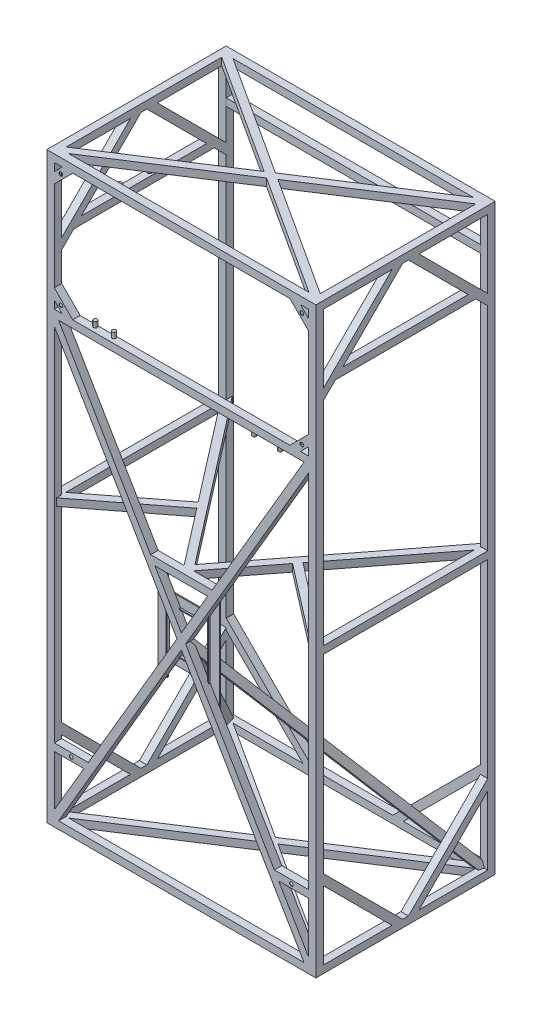
from build123d import *

# Parameters (mm, degrees)
SKETCH1_W                                      = 25.4
SKETCH1_H                                      = 25.4
SKETCH1_W_2                                    = 22.098
SKETCH1_H_2                                    = 22.098
SKETCH2_W                                      = 25.4
SKETCH2_H                                      = 25.4
SKETCH2_W_2                                    = 22.098
SKETCH2_H_2                                    = 22.098
SKETCH3_W                                      = 25.4
SKETCH3_H                                      = 25.4
SKETCH3_W_2                                    = 21.9456
SKETCH3_H_2                                    = 21.9456
CORNER_MAIN_BEAMS_REACH                        = 2033.524
SKETCH4_W                                      = 25.4
SKETCH4_H                                      = 25.4
SKETCH4_W_2                                    = 22.098
SKETCH4_H_2                                    = 22.098
SKETCH14_W                                     = 25.4
SKETCH14_H                                     = 25.4
BOSS_EXTRUDE2_DEPTH                            = 863.6
SKETCH7_W                                      = 25.4
SKETCH7_H                                      = 25.4
SKETCH7_W_2                                    = 22.098
SKETCH7_H_2                                    = 22.098
SKETCH6_W                                      = 25.4
SKETCH6_H                                      = 25.4
SKETCH6_W_2                                    = 22.098
SKETCH6_H_2                                    = 22.098
BOSS_EXTRUDE3_REACH                            = 1612.045
BOSS_EXTRUDE3_DIRECTION_2_REACH                = 1612.045
BOSS_EXTRUDE6_REACH                            = 1134.794
SKETCH30_W                                     = 25.4
SKETCH30_H                                     = 25.4
SKETCH30_W_2                                   = 22.098
SKETCH30_H_2                                   = 22.098
BOSS_EXTRUDE6_DIRECTION_2_REACH                = 1134.794
BOSS_EXTRUDE7_REACH                            = 2143.728
BOSS_EXTRUDE7_START                            = 127
SKETCH31_W                                     = 25.4
SKETCH31_H                                     = 25.4
SKETCH31_W_2                                   = 22.098
SKETCH31_H_2                                   = 22.098
BOSS_EXTRUDE7_DIRECTION_2_REACH                = 2143.728
MIRROR2_START                                  = 431.8
MIRROR2_DEPTH                                  = 25.4
MIRROR2_2_DEPTH                                = 1.651
MIRROR2_START_2                                = 455.549
MIRROR2_3_DEPTH                                = 1.651
MIRROR3_START                                  = -457.2
MIRROR3_DEPTH                                  = 25.4
MIRROR3_2_DEPTH                                = 1.651
MIRROR3_START_2                                = -433.451
MIRROR3_3_DEPTH                                = 1.651
BOSS_EXTRUDE8_REACH                            = 2092.803
BOSS_EXTRUDE8_START                            = -101.6
SKETCH32_W                                     = 25.4
SKETCH32_H                                     = 25.4
SKETCH32_W_2                                   = 22.098
SKETCH32_H_2                                   = 22.098
BOSS_EXTRUDE8_DIRECTION_2_REACH                = 2092.803
SKETCH33_W                                     = 107.95
SKETCH33_H                                     = 31.75
SKETCH33_W_2                                   = 31.75
SKETCH33_H_2                                   = 311.15
BOSS_EXTRUDE9_DEPTH                            = 3.4163
BOSS_EXTRUDE11_REACH                           = 1239.582
SKETCH37_W                                     = 25.4
SKETCH37_H                                     = 25.4
SKETCH37_W_2                                   = 22.098
SKETCH37_H_2                                   = 22.098
BOSS_EXTRUDE12_REACH                           = 1134.794
SKETCH38_W                                     = 25.4
SKETCH38_H                                     = 25.4
SKETCH38_W_2                                   = 22.098
SKETCH38_H_2                                   = 22.098
BOSS_EXTRUDE12_DIRECTION_2_REACH               = 1134.794
BOSS_EXTRUDE13_REACH                           = 1268.566
SKETCH39_W                                     = 25.4
SKETCH39_H                                     = 25.4
SKETCH39_W_2                                   = 22.098
SKETCH39_H_2                                   = 22.098
BOSS_EXTRUDE13_DIRECTION_2_REACH               = 1268.566
MIRROR6_START                                  = -50.8
MIRROR6_DEPTH                                  = 25.4
MIRROR6_2_DEPTH                                = 1.651
MIRROR6_START_2                                = -27.051
MIRROR6_3_DEPTH                                = 1.651
BOSS_EXTRUDE14_REACH                           = 1234.12
SKETCH40_W                                     = 25.4
SKETCH40_H                                     = 25.4
SKETCH40_W_2                                   = 22.225
SKETCH40_H_2                                   = 22.225
FUEL_SIDE_UPPER_TANK_GUIDE_REACH               = 1134.794
SKETCH42_W                                     = 25.4
SKETCH42_H                                     = 25.4
FUEL_SIDE_UPPER_TANK_GUIDE_DIRECTION_2_REACH   = 1134.794
LOWER_RIGHT_BLAST_SHIELD_MOUNT_REACH           = 1367.471
SKETCH41_W                                     = 25.4
SKETCH41_H                                     = 25.4
SKETCH41_W_2                                   = 22.225
SKETCH41_H_2                                   = 22.225
MIDDLE_RIGHT_BLAST_SHIELD_MOUNT_REACH          = 1961.027
MIDDLE_START                                   = 44.45
SKETCH43_W                                     = 25.4
SKETCH43_H                                     = 25.4
SKETCH43_W_2                                   = 22.225
SKETCH43_H_2                                   = 22.225
MIDDLE_RIGHT_BLAST_SHIELD_MOUNT_DIRECTIO_REACH = 1961.027
LEFT_START                                     = 279.4
LEFT_SIDE_BLAST_SHIELD_MOUNTS_DEPTH            = 25.4
LEFT_SIDE_BLAST_SHIELD_MOUNTS_2_DEPTH          = 1.5875
LEFT_START_2                                   = 303.2125
LEFT_SIDE_BLAST_SHIELD_MOUNTS_3_DEPTH          = 1.5875
BOSS_EXTRUDE20_DEPTH                           = 5.08
BOSS_EXTRUDE20_DEPTH_BACK                      = 3.4163
BOSS_EXTRUDE20_2_DEPTH                         = 5.08
BOSS_EXTRUDE20_2_DEPTH_BACK                    = 3.4163
BOSS_EXTRUDE20_3_DEPTH                         = 5.08
BOSS_EXTRUDE20_3_DEPTH_BACK                    = 3.4163
BOSS_EXTRUDE20_4_DEPTH                         = 5.08
BOSS_EXTRUDE20_4_DEPTH_BACK                    = 3.4163
SKETCH47_R                                     = 6.35
CUT_EXTRUDE3_DEPTH                             = 25.4
SKETCH46_R                                     = 6.35
CUT_EXTRUDE2_DEPTH                             = 1250.772923374
MIRROR15_COPY_1_SKETCH_R                       = 6.35
MIRROR15_COPY_1_DEPTH                          = 1250.772923374
SKETCH48_R                                     = 6.35
BOSS_EXTRUDE21_DEPTH                           = 19.05
SKETCH49_R                                     = 6.35
BOSS_EXTRUDE22_DEPTH                           = 19.05
SKETCH50_R                                     = 6.35
BOSS_EXTRUDE23_DEPTH                           = 19.05


with BuildPart() as part:
    # Top Box: sweep along a curve in space
    with BuildLine() as top_box_path:
        Line((0, 977.9, 292.1), (444.5, 977.9, 292.1))
        Line((444.5, 977.9, 292.1), (444.5, 977.9, -292.1))
        Line((444.5, 977.9, -292.1), (-444.5, 977.9, -292.1))
        Line((-444.5, 977.9, -292.1), (-444.5, 977.9, 292.1))
        Line((-444.5, 977.9, 292.1), (0, 977.9, 292.1))
    # Sketch1 → Top Box (sweep)
    with BuildSketch(Plane(origin=(0, 0, 0), x_dir=(0, 0, -1), z_dir=(1, 0, 0))):
        with Locations((-292.1, 977.9)):
            Rectangle(SKETCH1_W, SKETCH1_H)
        with Locations((-292.1, 977.9)):
            Rectangle(SKETCH1_W_2, SKETCH1_H_2, mode=Mode.SUBTRACT)
    sweep(path=top_box_path.line, transition=Transition.RIGHT)

    # Top X1: sweep along a curve in space
    with BuildLine() as top_x1_path:
        Line((-431.8, 977.9, -279.4), (431.8, 977.9, 279.4))
    # Sketch2 → Top X1 (sweep)
    with BuildSketch(Plane(origin=(-431.8, 0, -279.4), x_dir=(0.5432512781572741, 0, -0.8395701571521512), z_dir=(0.8395701571521512, 0, 0.5432512781572741))):
        with Locations((0, 977.9)):
            Rectangle(SKETCH2_W, SKETCH2_H)
        with Locations((0, 977.9)):
            Rectangle(SKETCH2_W_2, SKETCH2_H_2, mode=Mode.SUBTRACT)
    sweep(path=top_x1_path.line)

    # Top X2: sweep along a curve in space
    with BuildLine() as top_x2_path:
        Line((-431.8, 977.9, 279.4), (431.8, 977.9, -279.4))
    # Sketch3 → Top X2 (sweep)
    with BuildSketch(Plane(origin=(431.8, 0, -279.4), x_dir=(-0.5432512781572741, 0, -0.8395701571521513), z_dir=(0.8395701571521513, 0, -0.5432512781572741))):
        with Locations((0, 977.9)):
            Rectangle(SKETCH3_W, SKETCH3_H)
        with Locations((0, 977.9)):
            Rectangle(SKETCH3_W_2, SKETCH3_H_2, mode=Mode.SUBTRACT)
    sweep(path=top_x2_path.line)


with BuildPart() as body_2:
    # 2X3 bottom and X: mirrored copy
    add(part.part.mirror(Plane.ZX))


with BuildPart() as part_1:
    add(part.part)

    # Sketch4 → Corner Main Beams (add, up to next)
    with BuildSketch(Plane(origin=(0, -965.2, 0), x_dir=(1, 0, 0), z_dir=(0, 1, 0)), mode=Mode.PRIVATE) as corner_main_beams_sk1:
        with Locations((-444.5, -292.1)):
            Rectangle(SKETCH4_W, SKETCH4_H)
        with Locations((-444.5, -292.1)):
            Rectangle(SKETCH4_W_2, SKETCH4_H_2, mode=Mode.SUBTRACT)
    corner_main_beams_tool1 = extrude(corner_main_beams_sk1.sketch, amount=CORNER_MAIN_BEAMS_REACH, mode=Mode.PRIVATE) - part_1.part
    # Sketch4 → Corner Main Beams (add, up to next)
    with BuildSketch(Plane(origin=(0, -965.2, 0), x_dir=(1, 0, 0), z_dir=(0, 1, 0)), mode=Mode.PRIVATE) as corner_main_beams_sk2:
        with Locations((444.5, -292.1)):
            Rectangle(SKETCH4_W, SKETCH4_H)
        with Locations((444.5, -292.1)):
            Rectangle(SKETCH4_W_2, SKETCH4_H_2, mode=Mode.SUBTRACT)
    corner_main_beams_tool2 = extrude(corner_main_beams_sk2.sketch, amount=CORNER_MAIN_BEAMS_REACH, mode=Mode.PRIVATE) - part_1.part
    # Sketch4 → Corner Main Beams (add, up to next)
    with BuildSketch(Plane(origin=(0, -965.2, 0), x_dir=(1, 0, 0), z_dir=(0, 1, 0)), mode=Mode.PRIVATE) as corner_main_beams_sk3:
        with Locations((444.5, 292.1)):
            Rectangle(SKETCH4_W, SKETCH4_H)
        with Locations((444.5, 292.1)):
            Rectangle(SKETCH4_W_2, SKETCH4_H_2, mode=Mode.SUBTRACT)
    corner_main_beams_tool3 = extrude(corner_main_beams_sk3.sketch, amount=CORNER_MAIN_BEAMS_REACH, mode=Mode.PRIVATE) - part_1.part
    # Sketch4 → Corner Main Beams (add, up to next)
    with BuildSketch(Plane(origin=(0, -965.2, 0), x_dir=(1, 0, 0), z_dir=(0, 1, 0)), mode=Mode.PRIVATE) as corner_main_beams_sk4:
        with Locations((-444.5, 292.1)):
            Rectangle(SKETCH4_W, SKETCH4_H)
        with Locations((-444.5, 292.1)):
            Rectangle(SKETCH4_W_2, SKETCH4_H_2, mode=Mode.SUBTRACT)
    corner_main_beams_tool4 = extrude(corner_main_beams_sk4.sketch, amount=CORNER_MAIN_BEAMS_REACH, mode=Mode.PRIVATE) - part_1.part

    add(body_2.part)  # Corner Main Beams merges body 2
    add(corner_main_beams_tool1.solids().sort_by_distance((-444.5, -965.2, 304.44079))[0])
    add(corner_main_beams_tool2.solids().sort_by_distance((432.15921, -965.2, 292.1))[0])
    add(corner_main_beams_tool3.solids().sort_by_distance((444.5, -965.2, -304.44079))[0])
    add(corner_main_beams_tool4.solids().sort_by_distance((-432.15921, -965.2, -292.1))[0])

    # Sketch14 → Boss-Extrude2 (add)
    with BuildSketch(Plane(origin=(-431.8, 0, 0), x_dir=(0, 0, -1), z_dir=(1, 0, 0))):
        with Locations((-292.1, 520.7)):
            Rectangle(SKETCH14_W, SKETCH14_H)
    extrude(amount=BOSS_EXTRUDE2_DEPTH)

    # Front X1: sweep along a curve in space
    with BuildLine() as front_x1_path:
        Line((431.8, -965.2, 292.1), (-431.8, 508, 292.1))
    # Sketch7 → Front X1 (sweep)
    with BuildSketch(Plane(origin=(531.534336283, -906.735044248, 0), x_dir=(0.8626979700976566, 0.5057194997124227, 0), z_dir=(-0.5057194997124227, 0.8626979700976566, 0))):
        with Locations((-115.607477634, -292.1)):
            Rectangle(SKETCH7_W, SKETCH7_H)
        with Locations((-115.607477634, -292.1)):
            Rectangle(SKETCH7_W_2, SKETCH7_H_2, mode=Mode.SUBTRACT)
    sweep(path=front_x1_path.line)

    # Front X 2: sweep along a curve in space
    with BuildLine() as front_x_2_path:
        Line((-431.8, -965.2, 292.1), (431.8, 508, 292.1))
    # Sketch6 → Front X 2 (sweep)
    with BuildSketch(Plane(origin=(-531.534336283, -906.735044248, 0), x_dir=(0.8626979700976565, -0.5057194997124226, 0), z_dir=(0.5057194997124226, 0.8626979700976565, 0))):
        with Locations((115.607477634, -292.1)):
            Rectangle(SKETCH6_W, SKETCH6_H)
        with Locations((115.607477634, -292.1)):
            Rectangle(SKETCH6_W_2, SKETCH6_H_2, mode=Mode.SUBTRACT)
    sweep(path=front_x_2_path.line)

    # Sketch17 → Boss-Extrude3 (add, up to next)
    with BuildSketch(Plane(origin=(128.09702816, -447.118459802, 122.559815671), x_dir=(0.9073458854113775, 0.32526781479837374, 0.26631615212625476), z_dir=(-0.42026584041934634, 0.7169240807153511, 0.5562342005550085)), mode=Mode.PRIVATE) as boss_extrude3_sk1:
        Polygon((12.83923571, -12.559220772), (-12.559220772, -12.83923571), (-12.83923571, 12.559220772), (12.559220772, 12.83923571), align=None)
        Polygon((-11.170135067, 10.926522071), (-10.926522071, -11.170135067), (11.170135067, -10.926522071), (10.926522071, 11.170135067), align=None, mode=Mode.SUBTRACT)
    boss_extrude3_tool1 = extrude(boss_extrude3_sk1.sketch, amount=BOSS_EXTRUDE3_REACH, mode=Mode.PRIVATE) - part_1.part
    boss_extrude3 = boss_extrude3_tool1.solids().sort_by_distance((128.097028, -454.680914, 132.306979))[0]
    add(boss_extrude3)

    # Sketch17 → Boss-Extrude3 direction 2 (add, up to next)
    with BuildSketch(Plane(origin=(128.09702816, -447.118459802, 122.559815671), x_dir=(0.9073458854113775, 0.32526781479837374, 0.26631615212625476), z_dir=(-0.42026584041934634, 0.7169240807153511, 0.5562342005550085)), mode=Mode.PRIVATE) as boss_extrude3_direction_2_sk1:
        Polygon((12.83923571, -12.559220772), (-12.559220772, -12.83923571), (-12.83923571, 12.559220772), (12.559220772, 12.83923571), align=None)
        Polygon((-11.170135067, 10.926522071), (-10.926522071, -11.170135067), (11.170135067, -10.926522071), (10.926522071, 11.170135067), align=None, mode=Mode.SUBTRACT)
    boss_extrude3_direction_2_tool1 = extrude(boss_extrude3_direction_2_sk1.sketch, amount=-BOSS_EXTRUDE3_DIRECTION_2_REACH, mode=Mode.PRIVATE) - part_1.part
    boss_extrude3_direction_2 = boss_extrude3_direction_2_tool1.solids().sort_by_distance((128.097028, -454.680914, 132.306979))[0]
    add(boss_extrude3_direction_2)

    # Mirror9: Boss-Extrude3, Boss-Extrude3 direction 2 mirrored; each copy of Boss-Extrude3, Boss-Extrude3 direction 2 runs up to whatever stops it at its own place
    mirror9_before = part_1.part  # the part as the pattern finds it: every copy runs up to it
    mirror9_boss_extrude3_long = extrude(boss_extrude3_sk1.sketch, amount=BOSS_EXTRUDE3_REACH, mode=Mode.PRIVATE)
    mirror9_boss_extrude3_tool1 = mirror9_boss_extrude3_long.mirror(Plane(origin=(0, 0, 0), x_dir=(0, 0, 1), z_dir=(1, 0, 0))) - mirror9_before
    add(mirror9_boss_extrude3_tool1.solids().sort_by_distance((-128.097028, -454.680914, 132.306979))[0])
    mirror9_boss_extrude3_direction_2_long = extrude(boss_extrude3_direction_2_sk1.sketch, amount=-BOSS_EXTRUDE3_DIRECTION_2_REACH, mode=Mode.PRIVATE)
    mirror9_boss_extrude3_direction_2_tool1 = mirror9_boss_extrude3_direction_2_long.mirror(Plane(origin=(0, 0, 0), x_dir=(0, 0, 1), z_dir=(1, 0, 0))) - mirror9_before
    add(mirror9_boss_extrude3_direction_2_tool1.solids().sort_by_distance((-128.097028, -454.680914, 132.306979))[0])


with BuildPart() as body_2_2:

    # Sketch30 → Boss-Extrude6 (new, up to next)
    with BuildSketch(Plane.ZY, mode=Mode.PRIVATE) as boss_extrude6_sk1:
        with Locations((-292.1, 850.9)):
            Rectangle(SKETCH30_W, SKETCH30_H)
        with Locations((-292.1, 850.9)):
            Rectangle(SKETCH30_W_2, SKETCH30_H_2, mode=Mode.SUBTRACT)
    boss_extrude6_tool1 = extrude(boss_extrude6_sk1.sketch, amount=BOSS_EXTRUDE6_REACH, mode=Mode.PRIVATE) - part_1.part
    add(boss_extrude6_tool1.solids().sort_by_distance((0, 863.24079, -292.1))[0])


    # Sketch30 → Boss-Extrude6 direction 2 (add, up to next)
    with BuildSketch(Plane.ZY, mode=Mode.PRIVATE) as boss_extrude6_direction_2_sk1:
        with Locations((-292.1, 850.9)):
            Rectangle(SKETCH30_W, SKETCH30_H)
        with Locations((-292.1, 850.9)):
            Rectangle(SKETCH30_W_2, SKETCH30_H_2, mode=Mode.SUBTRACT)
    boss_extrude6_direction_2_tool1 = extrude(boss_extrude6_direction_2_sk1.sketch, amount=-BOSS_EXTRUDE6_DIRECTION_2_REACH, mode=Mode.PRIVATE) - part_1.part
    add(boss_extrude6_direction_2_tool1.solids().sort_by_distance((0, 863.24079, -292.1))[0])


with BuildPart() as part_2:
    add(part_1.part)

    # Boss-Extrude7: up to this plane
    boss_extrude7_end = Plane(origin=(-516.342048969, 965.2, 304.8), z_dir=(0, -1, 0))
    # Sketch31 → Boss-Extrude7 (add, up to the surface)
    with BuildSketch(Plane(origin=(444.5, 713.74, 279.4), x_dir=(1, 0, 0), z_dir=(0, 0.7071067811865718, -0.7071067811865234)).offset(BOSS_EXTRUDE7_START), mode=Mode.PRIVATE) as boss_extrude7_sk1:
        Rectangle(SKETCH31_W, SKETCH31_H)
        Rectangle(SKETCH31_W_2, SKETCH31_H_2, mode=Mode.SUBTRACT)
    boss_extrude7_tool1 = split(extrude(boss_extrude7_sk1.sketch, amount=BOSS_EXTRUDE7_REACH, mode=Mode.PRIVATE), bisect_by=boss_extrude7_end, keep=Keep.BOTH, mode=Mode.PRIVATE)
    boss_extrude7 = boss_extrude7_tool1.solids().sort_by_distance((444.5, 794.816305, 180.871183))[0]
    add(boss_extrude7)

    # Boss-Extrude7 direction 2: up to this plane
    boss_extrude7_direction_2_end = Plane(origin=(-457.2, 500000, 279.4), z_dir=(0, 0, 1))
    # Sketch31 → Boss-Extrude7 direction 2 (add, up to the surface)
    with BuildSketch(Plane(origin=(444.5, 713.74, 279.4), x_dir=(1, 0, 0), z_dir=(0, 0.7071067811865718, -0.7071067811865234)).offset(BOSS_EXTRUDE7_START), mode=Mode.PRIVATE) as boss_extrude7_direction_2_sk1:
        Rectangle(SKETCH31_W, SKETCH31_H)
        Rectangle(SKETCH31_W_2, SKETCH31_H_2, mode=Mode.SUBTRACT)
    boss_extrude7_direction_2_tool1 = split(extrude(boss_extrude7_direction_2_sk1.sketch, amount=-BOSS_EXTRUDE7_DIRECTION_2_REACH, mode=Mode.PRIVATE), bisect_by=boss_extrude7_direction_2_end, keep=Keep.BOTH, mode=Mode.PRIVATE)
    boss_extrude7_direction_2 = boss_extrude7_direction_2_tool1.solids().sort_by_distance((444.5, 794.816305, 180.871183))[0]
    add(boss_extrude7_direction_2)
    boss_extrude7 = boss_extrude7 + boss_extrude7_direction_2  # both directions under the feature's name, for the pattern or mirror that repeats it

    # Mirror1: Boss-Extrude7 across plane
    add(boss_extrude7.mirror(Plane.XY))

    # Mirror2: read off the stored shape, not the designer's step
    # Mirror2 outline → Mirror2 (add)
    with BuildSketch(Plane.YZ.offset(MIRROR2_START)):
        Polygon((-965.2, -43.565645651), (-965.2, -45.900512242), (-731.700512242, -279.4), (-729.365645651, -279.4), align=None)
        Polygon((-965.2, 12.314354349), (-965.2, 9.979487758), (-695.779487758, 279.4), (-698.114354349, 279.4), align=None)
        Polygon((-965.2, -9.979487758), (-965.2, -12.314354349), (-698.114354349, -279.4), (-695.779487758, -279.4), align=None)
        Polygon((-965.2, 45.900512242), (-965.2, 43.565645651), (-729.365645651, 279.4), (-731.700512242, 279.4), align=None)
    extrude(amount=MIRROR2_DEPTH)

    # Mirror2 2 outline → Mirror2 2 (add)
    with BuildSketch(Plane.YZ.offset(MIRROR2_START)):
        Polygon((-965.2, -12.314354349), (-965.2, -43.565645651), (-729.365645651, -279.4), (-698.114354349, -279.4), align=None)
        Polygon((-965.2, 43.565645651), (-965.2, 12.314354349), (-698.114354349, 279.4), (-729.365645651, 279.4), align=None)
    extrude(amount=MIRROR2_2_DEPTH)

    # Mirror2 3 outline → Mirror2 3 (add)
    with BuildSketch(Plane.YZ.offset(MIRROR2_START_2)):
        Polygon((-965.2, -12.314354349), (-965.2, -43.565645651), (-729.365645651, -279.4), (-698.114354349, -279.4), align=None)
        Polygon((-965.2, 43.565645651), (-965.2, 12.314354349), (-698.114354349, 279.4), (-729.365645651, 279.4), align=None)
    extrude(amount=MIRROR2_3_DEPTH)

    # Mirror3: read off the stored shape, not the designer's step
    # Mirror3 outline → Mirror3 (add)
    with BuildSketch(Plane.YZ.offset(MIRROR3_START)):
        Polygon((965.2, 45.900512242), (731.700512242, 279.4), (729.365645651, 279.4), (965.2, 43.565645651), align=None)
        Polygon((965.2, 12.314354349), (698.114354349, 279.4), (695.779487758, 279.4), (965.2, 9.979487758), align=None)
        Polygon((965.2, -12.314354349), (965.2, -9.979487758), (695.779487758, -279.4), (698.114354349, -279.4), align=None)
        Polygon((-965.2, 9.979487758), (-695.779487758, 279.4), (-698.114354349, 279.4), (-965.2, 12.314354349), align=None)
        Polygon((-698.114354349, -279.4), (-695.779487758, -279.4), (-965.2, -9.979487758), (-965.2, -12.314354349), align=None)
        Polygon((965.2, -45.900512242), (965.2, -43.565645651), (729.365645651, -279.400000001), (731.700512242, -279.4), align=None)
        Polygon((-965.2, 43.565645651), (-729.365645651, 279.400000001), (-731.700512242, 279.4), (-965.2, 45.900512242), align=None)
        Polygon((-731.700512242, -279.4), (-729.365645651, -279.4), (-965.2, -43.565645651), (-965.2, -45.900512242), align=None)
    extrude(amount=MIRROR3_DEPTH)

    # Mirror3 2 outline → Mirror3 2 (add)
    with BuildSketch(Plane.YZ.offset(MIRROR3_START)):
        Polygon((965.2, 43.565645651), (729.365645651, 279.4), (698.114354349, 279.4), (965.2, 12.314354349), align=None)
        Polygon((965.2, -43.565645651), (965.2, -12.314354349), (698.114354349, -279.4), (729.365645651, -279.4), align=None)
        Polygon((-965.2, 12.314354349), (-698.114354349, 279.4), (-729.365645651, 279.4), (-965.2, 43.565645651), align=None)
        Polygon((-729.365645651, -279.4), (-698.114354349, -279.4), (-965.2, -12.314354349), (-965.2, -43.565645651), align=None)
    extrude(amount=MIRROR3_2_DEPTH)

    # Mirror3 3 outline → Mirror3 3 (add)
    with BuildSketch(Plane.YZ.offset(MIRROR3_START_2)):
        Polygon((965.2, 43.565645651), (729.365645651, 279.4), (698.114354349, 279.4), (965.2, 12.314354349), align=None)
        Polygon((965.2, -43.565645651), (965.2, -12.314354349), (698.114354349, -279.4), (729.365645651, -279.4), align=None)
        Polygon((-965.2, 12.314354349), (-698.114354349, 279.4), (-729.365645651, 279.4), (-965.2, 43.565645651), align=None)
        Polygon((-729.365645651, -279.4), (-698.114354349, -279.4), (-965.2, -12.314354349), (-965.2, -43.565645651), align=None)
    extrude(amount=MIRROR3_3_DEPTH)

    # Boss-Extrude8: up to this plane
    boss_extrude8_end = Plane(origin=(431.8, 990.6, -279.4), z_dir=(1, 0, 0))
    # Sketch32 → Boss-Extrude8 (add, up to the surface)
    with BuildSketch(Plane(origin=(431.8, -685.8, -292.1), x_dir=(0.7071067811865479, -0.7071067811865472, 0), z_dir=(0.7071067811865472, 0.7071067811865479, 0)).offset(BOSS_EXTRUDE8_START), mode=Mode.PRIVATE) as boss_extrude8_sk1:
        Rectangle(SKETCH32_W, SKETCH32_H)
        Rectangle(SKETCH32_W_2, SKETCH32_H_2, mode=Mode.SUBTRACT)
    boss_extrude8_tool1 = split(extrude(boss_extrude8_sk1.sketch, amount=BOSS_EXTRUDE8_REACH, mode=Mode.PRIVATE), bisect_by=boss_extrude8_end, keep=Keep.BOTH, mode=Mode.PRIVATE)
    boss_extrude8 = boss_extrude8_tool1.solids().sort_by_distance((359.957951, -757.642049, -304.44079))[0]
    add(boss_extrude8)

    # Boss-Extrude8 direction 2: up to this plane
    boss_extrude8_direction_2_end = Plane(origin=(-516.342048969, -965.2, 304.8), z_dir=(0, 1, 0))
    # Sketch32 → Boss-Extrude8 direction 2 (add, up to the surface)
    with BuildSketch(Plane(origin=(431.8, -685.8, -292.1), x_dir=(0.7071067811865479, -0.7071067811865472, 0), z_dir=(0.7071067811865472, 0.7071067811865479, 0)).offset(BOSS_EXTRUDE8_START), mode=Mode.PRIVATE) as boss_extrude8_direction_2_sk1:
        Rectangle(SKETCH32_W, SKETCH32_H)
        Rectangle(SKETCH32_W_2, SKETCH32_H_2, mode=Mode.SUBTRACT)
    boss_extrude8_direction_2_tool1 = split(extrude(boss_extrude8_direction_2_sk1.sketch, amount=-BOSS_EXTRUDE8_DIRECTION_2_REACH, mode=Mode.PRIVATE), bisect_by=boss_extrude8_direction_2_end, keep=Keep.BOTH, mode=Mode.PRIVATE)
    boss_extrude8_direction_2 = boss_extrude8_direction_2_tool1.solids().sort_by_distance((359.957951, -757.642049, -304.44079))[0]
    add(boss_extrude8_direction_2)
    boss_extrude8 = boss_extrude8 + boss_extrude8_direction_2  # both directions under the feature's name, for the pattern or mirror that repeats it

    # Mirror4: Boss-Extrude8 across plane
    add(boss_extrude8.mirror(Plane(origin=(0, 0, 0), x_dir=(0, 0, 1), z_dir=(1, 0, 0))))

    # Sketch33 → Boss-Extrude9 (add)
    with BuildSketch(Plane(origin=(0, 0, 279.4), x_dir=(-1, 0, 0), z_dir=(0, 0, -1))):
        with Locations((0, -140.0175)):
            Rectangle(SKETCH33_W, SKETCH33_H)
        with Locations((0, -317.1825)):
            Rectangle(SKETCH33_W, SKETCH33_H)
        with Locations((-88.5825, -228.6)):
            Rectangle(SKETCH33_W_2, SKETCH33_H_2)
        with Locations((88.5825, -228.6)):
            Rectangle(SKETCH33_W_2, SKETCH33_H_2)
    extrude(amount=BOSS_EXTRUDE9_DEPTH)

    # Sketch37 → Boss-Extrude11 (add, up to next)
    with BuildSketch(Plane(origin=(0, 0, 279.4), x_dir=(-1, 0, 0), z_dir=(0, 0, -1)), mode=Mode.PRIVATE) as boss_extrude11_sk1:
        with Locations((444.5, -38.1)):
            Rectangle(SKETCH37_W, SKETCH37_H)
        with Locations((444.5, -38.1)):
            Rectangle(SKETCH37_W_2, SKETCH37_H_2, mode=Mode.SUBTRACT)
    boss_extrude11_tool1 = extrude(boss_extrude11_sk1.sketch, amount=BOSS_EXTRUDE11_REACH, mode=Mode.PRIVATE) - part_2.part
    boss_extrude11 = boss_extrude11_tool1.solids().sort_by_distance((-444.5, -25.75921, 279.4))[0]
    add(boss_extrude11)

    # Mirror5: Boss-Extrude11 across plane
    add(boss_extrude11.mirror(Plane(origin=(0, 0, 0), x_dir=(0, 0, 1), z_dir=(1, 0, 0))))



with BuildPart() as body_3:
    # Boss-Extrude12: up to this plane
    boss_extrude12_end = Plane(origin=(-420.84373578, 514.422637646, 279.4), z_dir=(-0.8626979700976565, -0.5057194997124227, 0))
    # Sketch38 → Boss-Extrude12 (new, up to the surface)
    with BuildSketch(Plane.ZY, mode=Mode.PRIVATE) as boss_extrude12_sk1:
        with Locations((292.1, -38.1)):
            Rectangle(SKETCH38_W, SKETCH38_H)
        with Locations((292.1, -38.1)):
            Rectangle(SKETCH38_W_2, SKETCH38_H_2, mode=Mode.SUBTRACT)
    boss_extrude12_tool1 = split(extrude(boss_extrude12_sk1.sketch, amount=BOSS_EXTRUDE12_REACH, mode=Mode.PRIVATE), bisect_by=boss_extrude12_end, keep=Keep.BOTH, mode=Mode.PRIVATE)
    add(boss_extrude12_tool1.solids().sort_by_distance((0, -25.75921, 292.1))[0])

    # Boss-Extrude12 direction 2: up to this plane
    boss_extrude12_direction_2_end = Plane(origin=(420.84373578, 514.422637646, 279.4), z_dir=(0.8626979700976565, -0.5057194997124227, 0))
    # Sketch38 → Boss-Extrude12 direction 2 (add, up to the surface)
    with BuildSketch(Plane.ZY, mode=Mode.PRIVATE) as boss_extrude12_direction_2_sk1:
        with Locations((292.1, -38.1)):
            Rectangle(SKETCH38_W, SKETCH38_H)
        with Locations((292.1, -38.1)):
            Rectangle(SKETCH38_W_2, SKETCH38_H_2, mode=Mode.SUBTRACT)
    boss_extrude12_direction_2_tool1 = split(extrude(boss_extrude12_direction_2_sk1.sketch, amount=-BOSS_EXTRUDE12_DIRECTION_2_REACH, mode=Mode.PRIVATE), bisect_by=boss_extrude12_direction_2_end, keep=Keep.BOTH, mode=Mode.PRIVATE)
    add(boss_extrude12_direction_2_tool1.solids().sort_by_distance((0, -25.75921, 292.1))[0])


with BuildPart() as part_3:
    add(part_2.part)

    add(body_3.part)  # Boss-Extrude13 merges body 3
    # Boss-Extrude13: up to this plane
    boss_extrude13_end = Plane(origin=(500000, -25.4, 279.4), z_dir=(0, 0, -1))
    # Sketch39 → Boss-Extrude13 (add, up to the surface)
    with BuildSketch(Plane(origin=(215.9, -38.1, 0), x_dir=(0.7912850013921422, 0, 0.6114475010757978), z_dir=(-0.6114475010757978, 0, 0.7912850013921422)), mode=Mode.PRIVATE) as boss_extrude13_sk1:
        Rectangle(SKETCH39_W, SKETCH39_H)
        Rectangle(SKETCH39_W_2, SKETCH39_H_2, mode=Mode.SUBTRACT)
    boss_extrude13_tool1 = split(extrude(boss_extrude13_sk1.sketch, amount=BOSS_EXTRUDE13_REACH, mode=Mode.PRIVATE), bisect_by=boss_extrude13_end, keep=Keep.BOTH, mode=Mode.PRIVATE)
    add(boss_extrude13_tool1.solids().sort_by_distance((215.9, -25.75921, 0))[0])

    # Boss-Extrude13 direction 2: up to this plane
    boss_extrude13_direction_2_end = Plane(origin=(431.8, 990.6, -279.4), z_dir=(1, 0, 0))
    # Sketch39 → Boss-Extrude13 direction 2 (add, up to the surface)
    with BuildSketch(Plane(origin=(215.9, -38.1, 0), x_dir=(0.7912850013921422, 0, 0.6114475010757978), z_dir=(-0.6114475010757978, 0, 0.7912850013921422)), mode=Mode.PRIVATE) as boss_extrude13_direction_2_sk1:
        Rectangle(SKETCH39_W, SKETCH39_H)
        Rectangle(SKETCH39_W_2, SKETCH39_H_2, mode=Mode.SUBTRACT)
    boss_extrude13_direction_2_tool1 = split(extrude(boss_extrude13_direction_2_sk1.sketch, amount=-BOSS_EXTRUDE13_DIRECTION_2_REACH, mode=Mode.PRIVATE), bisect_by=boss_extrude13_direction_2_end, keep=Keep.BOTH, mode=Mode.PRIVATE)
    add(boss_extrude13_direction_2_tool1.solids().sort_by_distance((215.9, -25.75921, 0))[0])

    # Mirror6: read off the stored shape, not the designer's step
    # Mirror6 outline → Mirror6 (add)
    with BuildSketch(Plane(origin=(0, 0, 0), x_dir=(1, 0, 0), z_dir=(0, 1, 0)).offset(MIRROR6_START)):
        Polygon((-431.8, 258.629615007), (-16.049842949, -279.4), (-15.006603157, -278.049924975), (-431.8, 261.329765057), align=None)
        Polygon((-431.8, 297.470234943), (-1.043239792, -259.979690032), (0, -258.629615007), (-431.8, 300.170384992), align=None)
    extrude(amount=MIRROR6_DEPTH)

    # Mirror6 2 outline → Mirror6 2 (add)
    with BuildSketch(Plane(origin=(0, 0, 0), x_dir=(1, 0, 0), z_dir=(0, 1, 0)).offset(MIRROR6_START)):
        Polygon((-431.8, 261.329765057), (-15.006603157, -278.049924975), (-1.043239792, -259.979690032), (-431.8, 297.470234943), align=None)
    extrude(amount=MIRROR6_2_DEPTH)

    # Mirror6 3 outline → Mirror6 3 (add)
    with BuildSketch(Plane(origin=(0, 0, 0), x_dir=(1, 0, 0), z_dir=(0, 1, 0)).offset(MIRROR6_START_2)):
        Polygon((-431.8, 261.329765057), (-15.006603157, -278.049924975), (-1.043239792, -259.979690032), (-431.8, 297.470234943), align=None)
    extrude(amount=MIRROR6_3_DEPTH)

    # Boss-Extrude14: up to this plane
    boss_extrude14_end = Plane(origin=(-431.8, 990.6, 279.4), z_dir=(-1, 0, 0))
    # Sketch40 → Boss-Extrude14 (add, up to the surface)
    with BuildSketch(Plane(origin=(-145.231208263, 0, 112.224115476), x_dir=(0.611447501075798, 0, 0.7912850013921419), z_dir=(-0.7912850013921419, 0, 0.611447501075798)), mode=Mode.PRIVATE) as boss_extrude14_sk1:
        with Locations((-41.352912324, -38.1)):
            Rectangle(SKETCH40_W, SKETCH40_H)
        with Locations((-41.352912324, -38.1)):
            Rectangle(SKETCH40_W_2, SKETCH40_H_2, mode=Mode.SUBTRACT)
    boss_extrude14_tool1 = split(extrude(boss_extrude14_sk1.sketch, amount=BOSS_EXTRUDE14_REACH, mode=Mode.PRIVATE), bisect_by=boss_extrude14_end, keep=Keep.BOTH, mode=Mode.PRIVATE)
    boss_extrude14 = boss_extrude14_tool1.solids().sort_by_distance((-170.516343, -25.75921, 79.502176))[0]
    add(boss_extrude14)

    # Mirror10: Boss-Extrude14 across plane
    add(boss_extrude14.mirror(Plane(origin=(0, 0, 0), x_dir=(0, 0, 1), z_dir=(1, 0, 0))))

    # Fuel side upper tank guide: up to this plane
    fuel_side_upper_tank_guide_end = Plane(origin=(431.8, -499023.653078981, 499998.832566704), z_dir=(0, -0.7071067811865234, -0.7071067811865718))
    # Sketch42 → Fuel side upper tank guide (add, up to the surface)
    with BuildSketch(Plane.XY, mode=Mode.PRIVATE) as fuel_side_upper_tank_guide_sk1:
        with Locations((444.5, 749.3)):
            Rectangle(SKETCH42_W, SKETCH42_H)
    fuel_side_upper_tank_guide_tool1 = split(extrude(fuel_side_upper_tank_guide_sk1.sketch, amount=FUEL_SIDE_UPPER_TANK_GUIDE_REACH, mode=Mode.PRIVATE), bisect_by=fuel_side_upper_tank_guide_end, keep=Keep.BOTH, mode=Mode.PRIVATE)
    fuel_side_upper_tank_guide = fuel_side_upper_tank_guide_tool1.solids().sort_by_distance((444.5, 749.3, 0))[0]
    add(fuel_side_upper_tank_guide)

    # Fuel side upper tank guide direction 2: up to this plane
    fuel_side_upper_tank_guide_direction_2_end = Plane(origin=(431.8, -499008.02743333, -499983.206921054), z_dir=(0, 0.7071067811865234, -0.7071067811865718))
    # Sketch42 → Fuel side upper tank guide direction 2 (add, up to the surface)
    with BuildSketch(Plane.XY, mode=Mode.PRIVATE) as fuel_side_upper_tank_guide_direction_2_sk1:
        with Locations((444.5, 749.3)):
            Rectangle(SKETCH42_W, SKETCH42_H)
    fuel_side_upper_tank_guide_direction_2_tool1 = split(extrude(fuel_side_upper_tank_guide_direction_2_sk1.sketch, amount=-FUEL_SIDE_UPPER_TANK_GUIDE_DIRECTION_2_REACH, mode=Mode.PRIVATE), bisect_by=fuel_side_upper_tank_guide_direction_2_end, keep=Keep.BOTH, mode=Mode.PRIVATE)
    fuel_side_upper_tank_guide_direction_2 = fuel_side_upper_tank_guide_direction_2_tool1.solids().sort_by_distance((444.5, 749.3, 0))[0]
    add(fuel_side_upper_tank_guide_direction_2)
    fuel_side_upper_tank_guide = fuel_side_upper_tank_guide + fuel_side_upper_tank_guide_direction_2  # both directions under the feature's name, for the pattern or mirror that repeats it

    # LOX side upper tank guide: Fuel side upper tank guide across plane
    add(fuel_side_upper_tank_guide.mirror(Plane(origin=(0, 0, 0), x_dir=(0, 0, 1), z_dir=(1, 0, 0))))

    # lower right blast shield mount: up to this plane
    lower_right_blast_shield_mount_end = Plane(origin=(-420.84373578, 514.422637646, 279.4), z_dir=(-0.8626979700976565, -0.5057194997124227, 0))
    # Sketch41 → lower right blast shield mount (add, up to the surface)
    with BuildSketch(Plane.ZY.offset(-431.8), mode=Mode.PRIVATE) as lower_right_blast_shield_mount_sk1:
        with Locations((292.1, -755.65)):
            Rectangle(SKETCH41_W, SKETCH41_H)
        with Locations((292.1, -755.65)):
            Rectangle(SKETCH41_W_2, SKETCH41_H_2, mode=Mode.SUBTRACT)
    lower_right_blast_shield_mount_tool1 = split(extrude(lower_right_blast_shield_mount_sk1.sketch, amount=LOWER_RIGHT_BLAST_SHIELD_MOUNT_REACH, mode=Mode.PRIVATE), bisect_by=lower_right_blast_shield_mount_end, keep=Keep.BOTH, mode=Mode.PRIVATE)
    add(lower_right_blast_shield_mount_tool1.solids().sort_by_distance((431.8, -743.30921, 292.1))[0])

    # middle right blast shield mount: up to this plane
    middle_right_blast_shield_mount_end = Plane(origin=(431.8, 533.4, 279.4), z_dir=(0, -1, 0))
    # Sketch43 → middle right blast shield mount (add, up to the surface)
    with BuildSketch(Plane(origin=(431.8, 596.534218899, 292.1), x_dir=(-0.7101711912199905, 0.7040290328964991, 0), z_dir=(-0.7040290328964991, -0.7101711912199905, 0)).offset(MIDDLE_START), mode=Mode.PRIVATE) as middle_right_blast_shield_mount_sk1:
        with Locations((-12.7, 0)):
            Rectangle(SKETCH43_W, SKETCH43_H)
        with Locations((-12.7, 0)):
            Rectangle(SKETCH43_W_2, SKETCH43_H_2, mode=Mode.SUBTRACT)
    middle_right_blast_shield_mount_tool1 = split(extrude(middle_right_blast_shield_mount_sk1.sketch, amount=MIDDLE_RIGHT_BLAST_SHIELD_MOUNT_REACH, mode=Mode.PRIVATE), bisect_by=middle_right_blast_shield_mount_end, keep=Keep.BOTH, mode=Mode.PRIVATE)
    middle_right_blast_shield_mount = middle_right_blast_shield_mount_tool1.solids().sort_by_distance((409.525084, 556.025941, 304.44079))[0]
    add(middle_right_blast_shield_mount)

    # middle right blast shield mount directio: up to this plane
    middle_right_blast_shield_mount_directio_end = Plane(origin=(431.8, 990.6, -279.4), z_dir=(1, 0, 0))
    # Sketch43 → middle right blast shield mount directio (add, up to the surface)
    with BuildSketch(Plane(origin=(431.8, 596.534218899, 292.1), x_dir=(-0.7101711912199905, 0.7040290328964991, 0), z_dir=(-0.7040290328964991, -0.7101711912199905, 0)).offset(MIDDLE_START), mode=Mode.PRIVATE) as middle_right_blast_shield_mount_directio_sk1:
        with Locations((-12.7, 0)):
            Rectangle(SKETCH43_W, SKETCH43_H)
        with Locations((-12.7, 0)):
            Rectangle(SKETCH43_W_2, SKETCH43_H_2, mode=Mode.SUBTRACT)
    middle_right_blast_shield_mount_directio_tool1 = split(extrude(middle_right_blast_shield_mount_directio_sk1.sketch, amount=-MIDDLE_RIGHT_BLAST_SHIELD_MOUNT_DIRECTIO_REACH, mode=Mode.PRIVATE), bisect_by=middle_right_blast_shield_mount_directio_end, keep=Keep.BOTH, mode=Mode.PRIVATE)
    middle_right_blast_shield_mount_directio = middle_right_blast_shield_mount_directio_tool1.solids().sort_by_distance((409.525084, 556.025941, 304.44079))[0]
    add(middle_right_blast_shield_mount_directio)
    middle_right_blast_shield_mount = middle_right_blast_shield_mount + middle_right_blast_shield_mount_directio  # both directions under the feature's name, for the pattern or mirror that repeats it

    # upper right blast Shield mount: middle right blast shield mount across plane
    add(middle_right_blast_shield_mount.mirror(Plane.ZX.offset(749.3)))

    # left side blast shield mounts: read off the stored shape, not the designer's step
    # left side blast shield mounts outline → left side blast shield mounts (add)
    with BuildSketch(Plane.XY.offset(LEFT_START)):
        Polygon((-317.167379392, -744.5375), (-316.236775944, -742.95), (-431.8, -742.95), (-431.8, -744.5375), align=None)
        Polygon((-431.8, 904.3206597), (-431.8, 902.0657811), (-369.211818975, 965.2), (-371.447195487, 965.2), align=None)
        Polygon((-331.126431116, -768.35), (-330.195827668, -766.7625), (-431.8, -766.7625), (-431.8, -768.35), align=None)
        Polygon((-431.8, 562.711039901), (-431.8, 560.456161301), (-404.97784316, 533.4), (-402.742466648, 533.4), align=None)
        Polygon((-431.8, 596.5342189), (-431.8, 594.2793403), (-371.447195487, 533.4), (-369.211818976, 533.4), align=None)
        Polygon((-431.8, 938.143838699), (-431.8, 935.888960099), (-402.742466648, 965.2), (-404.977843159, 965.2), align=None)
    extrude(amount=LEFT_SIDE_BLAST_SHIELD_MOUNTS_DEPTH)

    # left side blast shield mounts 2 outline → left side blast shield mounts 2 (add)
    with BuildSketch(Plane.XY.offset(LEFT_START)):
        Polygon((-330.195827668, -766.7625), (-317.167379392, -744.5375), (-431.8, -744.5375), (-431.8, -766.7625), align=None)
        Polygon((-431.8, 594.2793403), (-431.8, 562.711039901), (-402.742466648, 533.4), (-371.447195487, 533.4), align=None)
        Polygon((-431.8, 935.888960099), (-431.8, 904.3206597), (-371.447195487, 965.2), (-402.742466648, 965.2), align=None)
    extrude(amount=LEFT_SIDE_BLAST_SHIELD_MOUNTS_2_DEPTH)

    # left side blast shield mounts 3 outline → left side blast shield mounts 3 (add)
    with BuildSketch(Plane.XY.offset(LEFT_START_2)):
        Polygon((-330.195827668, -766.7625), (-317.167379392, -744.5375), (-431.8, -744.5375), (-431.8, -766.7625), align=None)
        Polygon((-431.8, 594.2793403), (-431.8, 562.711039901), (-402.742466648, 533.4), (-371.447195487, 533.4), align=None)
        Polygon((-431.8, 935.888960099), (-431.8, 904.3206597), (-371.447195487, 965.2), (-402.742466648, 965.2), align=None)
    extrude(amount=LEFT_SIDE_BLAST_SHIELD_MOUNTS_3_DEPTH)

    # Sketch47 → Cut-Extrude3 (cut)
    with BuildSketch(Plane.XY.offset(304.8)):
        with Locations((374.018387972, -755.65)):
            Circle(SKETCH47_R)
    cut_extrude3 = extrude(amount=-CUT_EXTRUDE3_DEPTH, mode=Mode.SUBTRACT)

    # Sketch46 → Cut-Extrude2 (cut, through all)
    with BuildSketch(Plane.XY.offset(304.8)):
        with Locations((409.447415534, 555.94759505)):
            Circle(SKETCH46_R)
    cut_extrude2 = extrude(amount=-CUT_EXTRUDE2_DEPTH, mode=Mode.SUBTRACT)

    # Mirror14: Cut-Extrude2 across plane
    add(cut_extrude2.mirror(Plane.ZX.offset(749.3)), mode=Mode.SUBTRACT)

    # Mirror15: Cut-Extrude3, Cut-Extrude2 across plane
    add(cut_extrude3.mirror(Plane(origin=(0, 0, 0), x_dir=(0, 0, 1), z_dir=(1, 0, 0))), mode=Mode.SUBTRACT)
    add(cut_extrude2.mirror(Plane(origin=(0, 0, 0), x_dir=(0, 0, 1), z_dir=(1, 0, 0))), mode=Mode.SUBTRACT)

    # Mirror15 copy 1 sketch → Mirror15 copy 1 (cut, through all)
    with BuildSketch(Plane(origin=(0, 1498.6, 304.8), x_dir=(-1, 0, 0), z_dir=(0, 0, 1))):
        with Locations((409.447415534, 555.94759505)):
            Circle(MIRROR15_COPY_1_SKETCH_R)
    extrude(amount=-MIRROR15_COPY_1_DEPTH, mode=Mode.SUBTRACT)

    # Sketch48 → Boss-Extrude21 (add)
    with BuildSketch(Plane(origin=(0, 762, 0), x_dir=(1, 0, 0), z_dir=(0, 1, 0))):
        with Locations(Location((-444.5, 31.75, 0), (0, 0, 90))):
            Circle(SKETCH48_R)
        with Locations(Location((-444.5, -69.85, 0), (0, 0, 90))):
            Circle(SKETCH48_R)
    extrude(amount=BOSS_EXTRUDE21_DEPTH)

    # Sketch49 → Boss-Extrude22 (add)
    with BuildSketch(Plane(origin=(0, 533.4, 0), x_dir=(1, 0, 0), z_dir=(0, 1, 0))):
        with Locations(Location((-311.15, -285.75, 0), (0, 0, 90))):
            Circle(SKETCH49_R)
        with Locations(Location((-247.65, -285.75, 0), (0, 0, 90))):
            Circle(SKETCH49_R)
    extrude(amount=BOSS_EXTRUDE22_DEPTH)

    # Sketch50 → Boss-Extrude23 (add)
    with BuildSketch(Plane.XZ.offset(-508)):
        with Locations(Location((323.85, 292.1, 0), (0, 0, 90))):
            Circle(SKETCH50_R)
        with Locations(Location((234.95, 292.1, 0), (0, 0, 90))):
            Circle(SKETCH50_R)
    extrude(amount=BOSS_EXTRUDE23_DEPTH)


with BuildPart() as body_3_2:
    # Sketch45 → Boss-Extrude20 (new, two sides: drawn at the far end of the back side and taken through both)
    with BuildSketch(Plane.XY.offset(279.4).offset(-BOSS_EXTRUDE20_DEPTH_BACK)):
        Polygon((72.7075, -129.682294257), (72.7075, -327.517705743), (69.2912, -321.68989986), (69.2912, -135.51010014), align=None)
    extrude(amount=BOSS_EXTRUDE20_DEPTH + BOSS_EXTRUDE20_DEPTH_BACK)


with BuildPart() as body_4:
    # Sketch45 → Boss-Extrude20 2 (new, two sides: drawn at the far end of the back side and taken through both)
    with BuildSketch(Plane.XY.offset(279.4).offset(-BOSS_EXTRUDE20_2_DEPTH_BACK)):
        Polygon((-69.2912, -135.51010014), (-72.7075, -129.682294257), (-72.7075, -327.517705743), (-69.2912, -321.68989986), align=None)
    extrude(amount=BOSS_EXTRUDE20_2_DEPTH + BOSS_EXTRUDE20_2_DEPTH_BACK)


with BuildPart() as body_5:
    # Sketch45 → Boss-Extrude20 3 (new, two sides: drawn at the far end of the back side and taken through both)
    with BuildSketch(Plane.XY.offset(279.4).offset(-BOSS_EXTRUDE20_3_DEPTH_BACK)):
        Polygon((-27.900379228, -155.8925), (27.900379228, -155.8925), (25.897720608, -159.3088), (-25.897720608, -159.3088), align=None)
    extrude(amount=BOSS_EXTRUDE20_3_DEPTH + BOSS_EXTRUDE20_3_DEPTH_BACK)


with BuildPart() as body_6:
    # Sketch45 → Boss-Extrude20 4 (new, two sides: drawn at the far end of the back side and taken through both)
    with BuildSketch(Plane.XY.offset(279.4).offset(-BOSS_EXTRUDE20_4_DEPTH_BACK)):
        Polygon((27.900379228, -301.3075), (25.897720608, -297.8912), (-25.897720608, -297.8912), (-27.900379228, -301.3075), align=None)
    extrude(amount=BOSS_EXTRUDE20_4_DEPTH + BOSS_EXTRUDE20_4_DEPTH_BACK)


solid = Compound([body_2_2.part, part_3.part, body_3_2.part, body_4.part, body_5.part, body_6.part])
